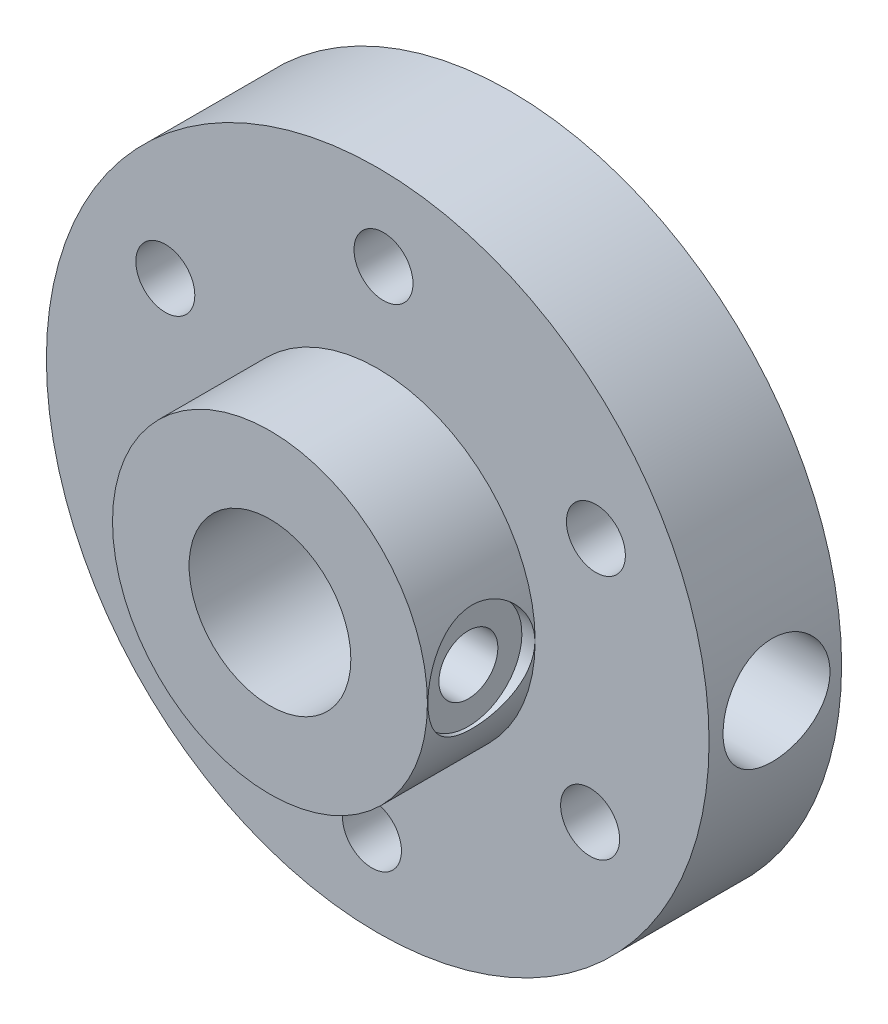
from build123d import *

# Parameters (mm, degrees)
SKETCH1_R                  = 12.7
BOSS_EXTRUDE1_DEPTH        = 5.08
SKETCH2_R                  = 6.035
BOSS_EXTRUDE2_DEPTH        = 4.13
CUT_EXTRUDE1_REACH         = 22.184
SKETCH3_R                  = 3.1
CRVPATTERN1_OUTLINE_R      = 1.1303
CRVPATTERN1_DEPTH          = 5.08
SKETCH16_R                 = 2.05
CUT_EXTRUDE2_DEPTH         = 0.5
F_4_40_TAPPED_HOLE3_REACH  = 26.055
F_4_40_TAPPED_HOLE3_BORE_R = 1.1303
SKETCH24_R                 = 2.05
CUT_EXTRUDE3_DEPTH         = 7.1
F_4_40_TAPPED_HOLE4_REACH  = 26.104
F_4_40_TAPPED_HOLE4_BORE_R = 1.1303


# Read off the part's stored shape, not the designer's step: CrvPattern1
with BuildPart() as part:
    # Sketch1 → Boss-Extrude1 (new body)
    with BuildSketch(Plane.XY):
        Circle(SKETCH1_R)
    extrude(amount=BOSS_EXTRUDE1_DEPTH)

    # Sketch2 → Boss-Extrude2 (add)
    with BuildSketch(Plane.XY.offset(5.08)):
        Circle(SKETCH2_R)
    extrude(amount=BOSS_EXTRUDE2_DEPTH)

    # Sketch3 → Cut-Extrude1 (cut, up to next)
    with BuildSketch(Plane.XY.offset(9.21), mode=Mode.PRIVATE) as cut_extrude1_sk1:
        Circle(SKETCH3_R)
    cut_extrude1_tool1 = extrude(cut_extrude1_sk1.sketch, amount=-CUT_EXTRUDE1_REACH, mode=Mode.PRIVATE) & part.part
    add(cut_extrude1_tool1.solids().sort_by_distance((0, 0, 9.21))[0], mode=Mode.SUBTRACT)

    # Sketch10 → #4-40 Tapped Hole2 (revolve, cut)
    with BuildSketch(Plane(origin=(0.221066647, 9.527435622, 5.08), x_dir=(0, -1, 0), z_dir=(1, 0, 0))):
        Polygon((0, 0), (0, 8.279152758), (1.1303, 7.6), (1.1303, 0), align=None)
    revolve(axis=Axis((0.221066647, 9.527435622, 11.43), (0, 0, -1)), mode=Mode.SUBTRACT)

    # CrvPattern1 outline → CrvPattern1 (cut)
    with BuildSketch(Plane.XY):
        with Locations((-8.140467958, 4.955167144)):
            Circle(CRVPATTERN1_OUTLINE_R)
        with Locations((-8.361534605, -4.572268479)):
            Circle(CRVPATTERN1_OUTLINE_R)
        with Locations((-0.221066647, -9.527435622)):
            Circle(CRVPATTERN1_OUTLINE_R)
        with Locations((8.140467958, -4.955167144)):
            Circle(CRVPATTERN1_OUTLINE_R)
        with Locations((8.361534605, 4.572268479)):
            Circle(CRVPATTERN1_OUTLINE_R)
    extrude(amount=CRVPATTERN1_DEPTH, mode=Mode.SUBTRACT)

    # Sketch16 → Cut-Extrude2 (cut)
    with BuildSketch(Plane(origin=(6.035, 0, 9.21), x_dir=(0, 0, -1), z_dir=(1, 0, 0))):
        with Locations(Location((2.069027283, 0, 0), (0, 0, 90))):
            Circle(SKETCH16_R)
    extrude(amount=-CUT_EXTRUDE2_DEPTH, mode=Mode.SUBTRACT)

    # #4-40 Tapped Hole3 bore → #4-40 Tapped Hole3 (cut, up to next)
    with BuildSketch(Plane(origin=(5.535, 0, 0), x_dir=(0, 0, -1), z_dir=(1, 0, 0)), mode=Mode.PRIVATE) as f_4_40_tapped_hole3_sk1:
        with Locations((-7.140972717, 0)):
            Circle(F_4_40_TAPPED_HOLE3_BORE_R)
    f_4_40_tapped_hole3_tool1 = extrude(f_4_40_tapped_hole3_sk1.sketch, amount=-F_4_40_TAPPED_HOLE3_REACH, mode=Mode.PRIVATE) & part.part
    add(f_4_40_tapped_hole3_tool1.solids().sort_by_distance((5.535, 0, 7.140973))[0], mode=Mode.SUBTRACT)

    # Sketch24 → Cut-Extrude3 (cut)
    with BuildSketch(Plane(origin=(12.7, 0, 5.08), x_dir=(0, 0, -1), z_dir=(1, 0, 0))):
        with Locations(Location((2.585319139, 0, 0), (0, 0, 90))):
            Circle(SKETCH24_R)
    extrude(amount=-CUT_EXTRUDE3_DEPTH, mode=Mode.SUBTRACT)

    # #4-40 Tapped Hole4 bore → #4-40 Tapped Hole4 (cut, up to next)
    with BuildSketch(Plane(origin=(5.6, 0, 0), x_dir=(0, 0, -1), z_dir=(1, 0, 0)), mode=Mode.PRIVATE) as f_4_40_tapped_hole4_sk1:
        with Locations((-2.494680861, 0)):
            Circle(F_4_40_TAPPED_HOLE4_BORE_R)
    f_4_40_tapped_hole4_tool1 = extrude(f_4_40_tapped_hole4_sk1.sketch, amount=-F_4_40_TAPPED_HOLE4_REACH, mode=Mode.PRIVATE) & part.part
    add(f_4_40_tapped_hole4_tool1.solids().sort_by_distance((5.6, 0, 2.494681))[0], mode=Mode.SUBTRACT)


solid = part.part
